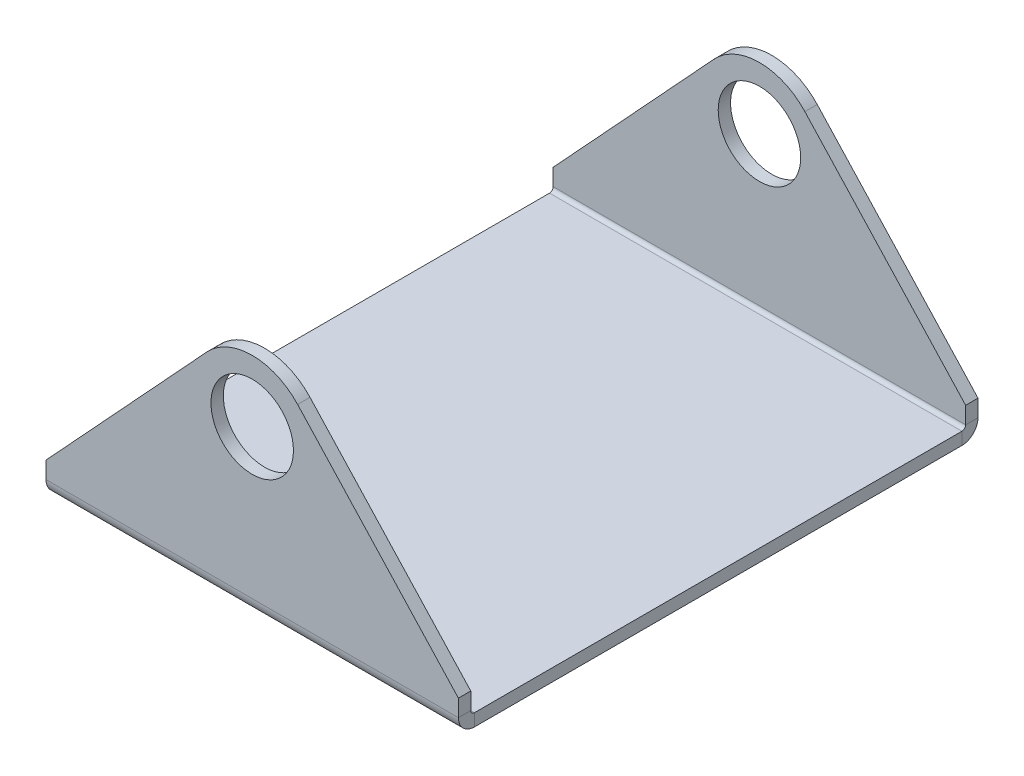
from build123d import *

# Parameters (mm, degrees)
ESBO_O1_W                      = 100
ESBO_O1_H                      = 120
RESSALTO_EXTRUS_O1_DEPTH       = 3
ARESTA_FLANGE1_STRIP_W         = 13.8
ARESTA_FLANGE1_STRIP_H         = 3
ARESTA_FLANGE1_STRIP_CUT_DEPTH = 100
ARESTA_FLANGE1_DEPTH           = 100
ARESTA_FLANGE2_STRIP_W         = 13.8
ARESTA_FLANGE2_STRIP_H         = 3
ARESTA_FLANGE2_STRIP_CUT_DEPTH = 100
ARESTA_FLANGE2_DEPTH           = 100
CORTE_EXTRUS_O1_DEPTH          = 171.002941151
ESBO_O13_R                     = 10
CORTE_EXTRUS_O2_DEPTH          = 171.002941151
DESDOBRAR1_START               = 3
DESDOBRAR1_OUTLINE_W           = 100
DESDOBRAR1_OUTLINE_H           = 126
DESDOBRAR1_DEPTH               = 53
DESDOBRAR1_2_OUTLINE_R         = 10
DESDOBRAR1_2_DEPTH             = 3
DOBRAR1_START                  = -175
DOBRAR1_OUTLINE_W              = 100
DOBRAR1_OUTLINE_H              = 3
DOBRAR1_DEPTH                  = 52
DOBRAR1_START_2                = 3
DOBRAR1_2_OUTLINE_W            = 100
DOBRAR1_2_OUTLINE_H            = 3
DOBRAR1_2_DEPTH                = 52
DOBRAR1_START_3                = -123
DOBRAR1_3_OUTLINE_R            = 10
DOBRAR1_3_DEPTH                = 3.9
DOBRAR1_START_4                = -0.9
DOBRAR1_4_OUTLINE_R            = 10
DOBRAR1_4_DEPTH                = 3.9
DOBRAR1_START_5                = -1
DOBRAR1_5_DEPTH                = 102


with BuildPart() as part:
    # Esboço1 → Ressalto-extrusão1 (new body)
    with BuildSketch(Plane(origin=(0, 0, 0), x_dir=(1, 0, 0), z_dir=(0, 1, 0))):
        with Locations((50, 60)):
            Rectangle(ESBO_O1_W, ESBO_O1_H)
    extrude(amount=RESSALTO_EXTRUS_O1_DEPTH)

    # Aresta-Flange1: sheet metal written as solids
    # Aresta-Flange1 strip (on a plane across the edge) → Aresta-Flange1 strip cut (cut)
    with BuildSketch(Plane(origin=(0, 3, 0), x_dir=(0, 0, -1), z_dir=(1, 0, 0))):
        with Locations((-6, -1.5)):
            Rectangle(ARESTA_FLANGE1_STRIP_W, ARESTA_FLANGE1_STRIP_H)
    extrude(amount=ARESTA_FLANGE1_STRIP_CUT_DEPTH, mode=Mode.SUBTRACT)

    # Aresta-Flange1 section (on a plane across the edge) → Aresta-Flange1 (add)
    with BuildSketch(Plane(origin=(0, 3, 0), x_dir=(0, 0, -1), z_dir=(1, 0, 0))):
        with BuildLine():
            Line((-3, 0.9), (-3, 52))
            Line((-3, 52), (0, 52))
            Line((0, 52), (0, 0.9))
            ThreePointArc((0, 0.9), (0.263603897, 0.263603897), (0.9, 0))
            Line((0.9, 0), (0.9, -3))
            ThreePointArc((0.9, -3), (-1.857716447, -1.857716447), (-3, 0.9))
        make_face()
    extrude(amount=ARESTA_FLANGE1_DEPTH)

    # Aresta-Flange2: sheet metal written as solids
    # Aresta-Flange2 strip (on a plane across the edge) → Aresta-Flange2 strip cut (cut)
    with BuildSketch(Plane(origin=(100, 3, -120), x_dir=(0, 0, 1), z_dir=(-1, 0, 0))):
        with Locations((-6, -1.5)):
            Rectangle(ARESTA_FLANGE2_STRIP_W, ARESTA_FLANGE2_STRIP_H)
    extrude(amount=ARESTA_FLANGE2_STRIP_CUT_DEPTH, mode=Mode.SUBTRACT)

    # Aresta-Flange2 section (on a plane across the edge) → Aresta-Flange2 (add)
    with BuildSketch(Plane(origin=(100, 3, -120), x_dir=(0, 0, 1), z_dir=(-1, 0, 0))):
        with BuildLine():
            Line((-3, 0.9), (-3, 52))
            Line((-3, 52), (0, 52))
            Line((0, 52), (0, 0.9))
            ThreePointArc((0, 0.9), (0.263603897, 0.263603897), (0.9, 0))
            Line((0.9, 0), (0.9, -3))
            ThreePointArc((0.9, -3), (-1.857716447, -1.857716447), (-3, 0.9))
        make_face()
    extrude(amount=ARESTA_FLANGE2_DEPTH)

    # Esboço11 → Corte-extrusão1 (cut, through all)
    with BuildSketch(Plane.XY.offset(3)):
        with BuildLine():
            Line((0, 55), (0, 8))
            Line((0, 8), (38.984187706, 50.180956709))
            ThreePointArc((38.984187706, 50.180956709), (43.988109725, 53.74253162), (50, 55))
            Line((50, 55), (0, 55))
        make_face()
        with BuildLine():
            Line((61.015812294, 50.180956709), (100, 8))
            Line((100, 8), (100, 55))
            Line((100, 55), (50, 55))
            ThreePointArc((50, 55), (56.011890275, 53.74253162), (61.015812294, 50.180956709))
        make_face()
    extrude(amount=-CORTE_EXTRUS_O1_DEPTH, mode=Mode.SUBTRACT)

    # Esboço13 → Corte-extrusão2 (cut, through all)
    with BuildSketch(Plane.XY.offset(3)):
        with Locations((50, 40)):
            Circle(ESBO_O13_R)
    extrude(amount=-CORTE_EXTRUS_O2_DEPTH, mode=Mode.SUBTRACT)

    # Desdobrar1: read off the stored shape, not the designer's step
    # Desdobrar1 outline → Desdobrar1 (cut)
    with BuildSketch(Plane(origin=(0, 0, 0), x_dir=(1, 0, 0), z_dir=(0, 1, 0)).offset(DESDOBRAR1_START)):
        with Locations((50, 60)):
            Rectangle(DESDOBRAR1_OUTLINE_W, DESDOBRAR1_OUTLINE_H)
    extrude(amount=DESDOBRAR1_DEPTH, mode=Mode.SUBTRACT)

    # Desdobrar1 2 outline → Desdobrar1 2 (add)
    with BuildSketch(Plane(origin=(0, 0, 0), x_dir=(1, 0, 0), z_dir=(0, 1, 0))):
        with BuildLine():
            Line((0, -6.969911184), (38.984187706, -49.150867893))
            ThreePointArc((38.984187706, -49.150867893), (50, -53.969911184), (61.015812294, -49.150867893))
            Line((61.015812294, -49.150867893), (100, -6.969911184))
            Line((100, -6.969911184), (100, 126.969911184))
            Line((100, 126.969911184), (61.015812294, 169.150867893))
            ThreePointArc((61.015812294, 169.150867893), (50, 173.969911184), (38.984187706, 169.150867893))
            Line((38.984187706, 169.150867893), (0, 126.969911184))
            Line((0, 126.969911184), (0, -6.969911184))
        make_face()
        with Locations((50, 158.969911184)):
            Circle(DESDOBRAR1_2_OUTLINE_R, mode=Mode.SUBTRACT)
        with Locations((50, -38.969911184)):
            Circle(DESDOBRAR1_2_OUTLINE_R, mode=Mode.SUBTRACT)
    extrude(amount=DESDOBRAR1_2_DEPTH)

    # Dobrar1: read off the stored shape, not the designer's step
    # Dobrar1 outline → Dobrar1 (cut)
    with BuildSketch(Plane.XY.offset(DOBRAR1_START)):
        with Locations((50, 1.5)):
            Rectangle(DOBRAR1_OUTLINE_W, DOBRAR1_OUTLINE_H)
    extrude(amount=DOBRAR1_DEPTH, mode=Mode.SUBTRACT)

    # Dobrar1 2 outline → Dobrar1 2 (cut)
    with BuildSketch(Plane.XY.offset(DOBRAR1_START_2)):
        with Locations((50, 1.5)):
            Rectangle(DOBRAR1_2_OUTLINE_W, DOBRAR1_2_OUTLINE_H)
    extrude(amount=DOBRAR1_2_DEPTH, mode=Mode.SUBTRACT)

    # Dobrar1 3 outline → Dobrar1 3 (add)
    with BuildSketch(Plane.XY.offset(DOBRAR1_START_3)):
        with BuildLine():
            Line((0, 8), (0, 3))
            Line((0, 3), (100, 3))
            Line((100, 3), (100, 8))
            Line((100, 8), (61.015812294, 50.180956709))
            ThreePointArc((61.015812294, 50.180956709), (50, 55), (38.984187706, 50.180956709))
            Line((38.984187706, 50.180956709), (0, 8))
        make_face()
        with Locations((50, 40)):
            Circle(DOBRAR1_3_OUTLINE_R, mode=Mode.SUBTRACT)
    extrude(amount=DOBRAR1_3_DEPTH)

    # Dobrar1 4 outline → Dobrar1 4 (add)
    with BuildSketch(Plane.XY.offset(DOBRAR1_START_4)):
        with BuildLine():
            Line((0, 8), (0, 3))
            Line((0, 3), (100, 3))
            Line((100, 3), (100, 8))
            Line((100, 8), (61.015812294, 50.180956709))
            ThreePointArc((61.015812294, 50.180956709), (50, 55), (38.984187706, 50.180956709))
            Line((38.984187706, 50.180956709), (0, 8))
        make_face()
        with Locations((50, 40)):
            Circle(DOBRAR1_4_OUTLINE_R, mode=Mode.SUBTRACT)
    extrude(amount=DOBRAR1_4_DEPTH)

    # Dobrar1 5 outline → Dobrar1 5 (cut)
    with BuildSketch(Plane.YZ.offset(DOBRAR1_START_5)):
        with BuildLine():
            Line((56, 0), (3.9, 0))
            ThreePointArc((3.9, 0), (3.263603897, -0.263603897), (3, -0.9))
            Line((3, -0.9), (56, -0.9))
            Line((56, -0.9), (56, 0))
        make_face()
        with BuildLine():
            Line((3.9, 3), (56, 2.999999983))
            Line((56, 2.999999983), (56, 5))
            Line((56, 5), (4e-08, 5))
            Line((4e-08, 5), (0, -0.9))
            ThreePointArc((0, -0.9), (1.142283553, 1.857716447), (3.9, 3))
        make_face()
        with BuildLine():
            Line((56, -120), (56, -119.1))
            Line((56, -119.1), (3, -119.1))
            ThreePointArc((3, -119.1), (3.263603897, -119.736396103), (3.9, -120))
            Line((3.9, -120), (56, -120))
        make_face()
        with BuildLine():
            Line((56, -124), (56, -122.999999983))
            Line((56, -122.999999983), (3.9, -123))
            ThreePointArc((3.9, -123), (1.142283553, -121.857716447), (0, -119.1))
            Line((0, -119.1), (4e-08, -124))
            Line((4e-08, -124), (56, -124))
        make_face()
    extrude(amount=DOBRAR1_5_DEPTH, mode=Mode.SUBTRACT)


solid = part.part
